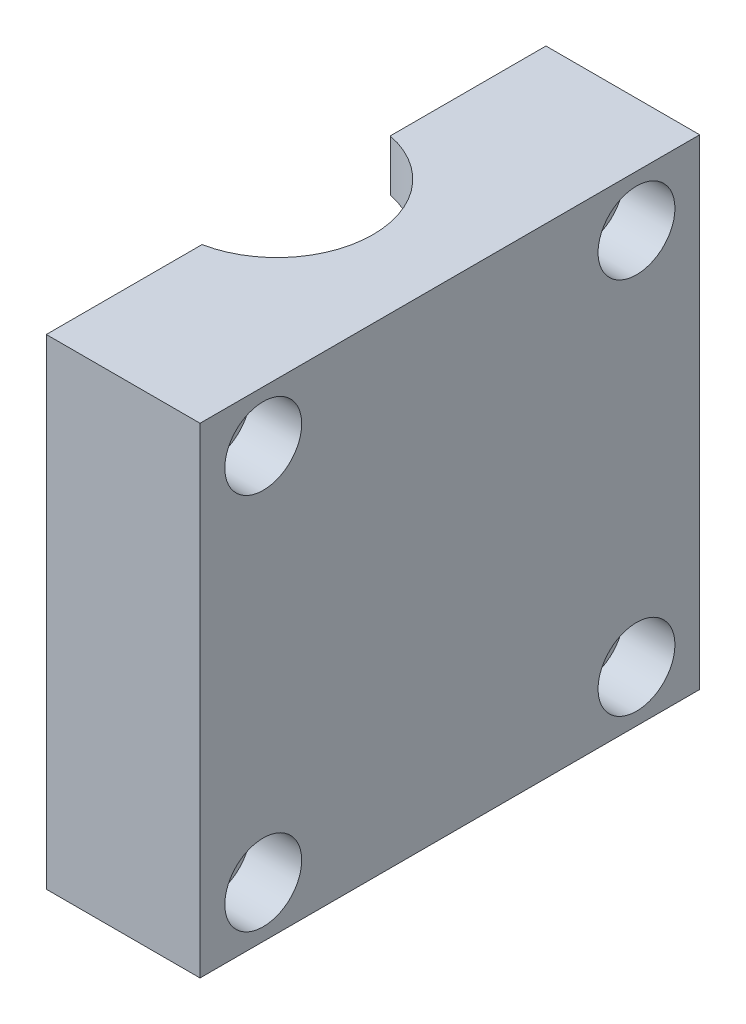
from build123d import *

# Parameters (mm, degrees)
BOSS_EXTRU_1_DEPTH      = 37.5
BOSS_EXTRU_2_DEPTH      = 4
ESQUISSE3_R             = 2
ENL_V_MAT_EXTRU_1_DEPTH = 56.418859606
ESQUISSE5_R             = 3
ENL_V_MAT_EXTRU_2_DEPTH = 4


with BuildPart() as part:
    # Esquisse1 → Boss.-Extru.1 (new body)
    with BuildSketch(Plane(origin=(0, 0, 0), x_dir=(1, 0, 0), z_dir=(0, 1, 0))):
        with BuildLine():
            Line((0, 29.133924434), (0, 39))
            Line((0, 39), (12, 39))
            Line((12, 39), (12, 0))
            Line((12, 0), (0, 0))
            Line((0, 0), (0, 9.866075566))
            ThreePointArc((0, 9.866075566), (8.25, 19.5), (0, 29.133924434))
        make_face()
    extrude(amount=BOSS_EXTRU_1_DEPTH)

    # Esquisse2 → Boss.-Extru.2 (add)
    with BuildSketch(Plane.XZ):
        with BuildLine():
            Line((0, 0), (12, 0))
            Line((12, 0), (12, -39))
            Line((12, -39), (0, -39))
            Line((0, -39), (0, -26.848469228))
            ThreePointArc((0, -26.848469228), (6, -19.5), (0, -12.151530772))
            Line((0, -12.151530772), (0, 0))
        make_face()
    boss_extru_2 = extrude(amount=-BOSS_EXTRU_2_DEPTH)

    # Symétrie1: Boss.-Extru.2 across plane
    add(boss_extru_2.mirror(Plane.ZX.offset(18.75)))

    # Esquisse3 → Enlèv. mat.-Extru.1 (cut, through all)
    with BuildSketch(Plane.ZY):
        with Locations((-34.066962217, 33.5)):
            Circle(ESQUISSE3_R)
        with Locations((-34.066962217, 4)):
            Circle(ESQUISSE3_R)
        with Locations((-4.933037783, 4)):
            Circle(ESQUISSE3_R)
        with Locations((-4.933037783, 33.5)):
            Circle(ESQUISSE3_R)
    extrude(amount=-ENL_V_MAT_EXTRU_1_DEPTH, mode=Mode.SUBTRACT)

    # Esquisse5 → Enlèv. mat.-Extru.2 (cut)
    with BuildSketch(Plane(origin=(12, 0, 0), x_dir=(0, 0, -1), z_dir=(1, 0, 0))):
        with Locations((4.933037783, 33.5)):
            Circle(ESQUISSE5_R)
        with Locations((34.066962217, 33.5)):
            Circle(ESQUISSE5_R)
        with Locations((34.066962217, 4)):
            Circle(ESQUISSE5_R)
        with Locations((4.933037783, 4)):
            Circle(ESQUISSE5_R)
    extrude(amount=-ENL_V_MAT_EXTRU_2_DEPTH, mode=Mode.SUBTRACT)


solid = part.part
